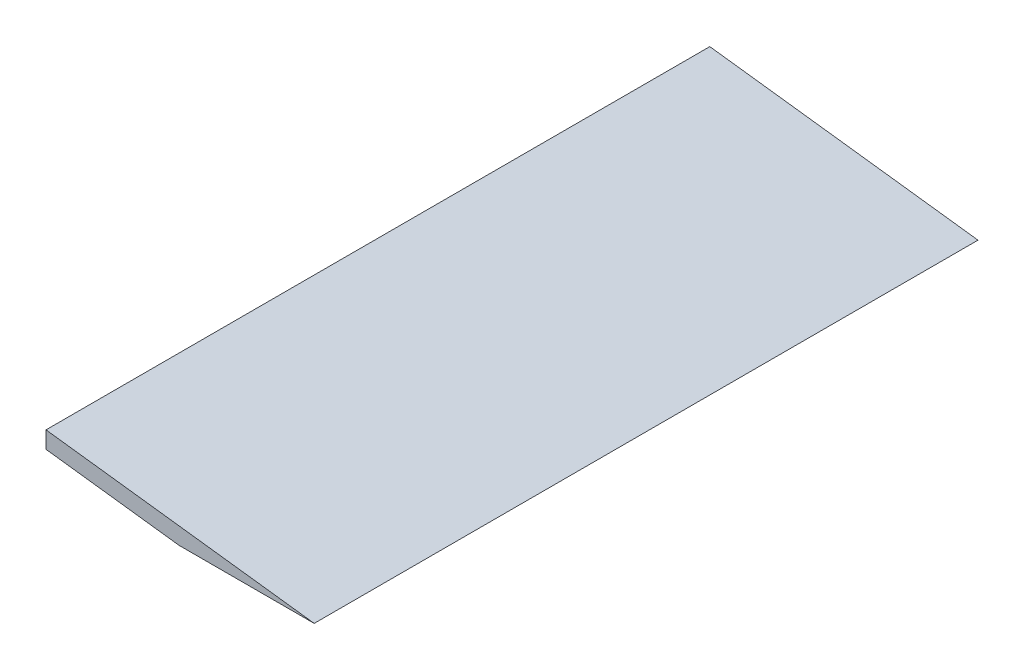
from build123d import *

# Parameters (mm, degrees)
BOSS_EXTRUDE1_DEPTH = 125.73


with BuildPart() as part:
    # Sketch1 → Boss-Extrude1 (new body)
    with BuildSketch(Plane.XY):
        Polygon((0, 0), (50.8, -6.35), (25.202331649, -6.35), (0, -3.199708544), align=None)
    extrude(amount=BOSS_EXTRUDE1_DEPTH)


solid = part.part
